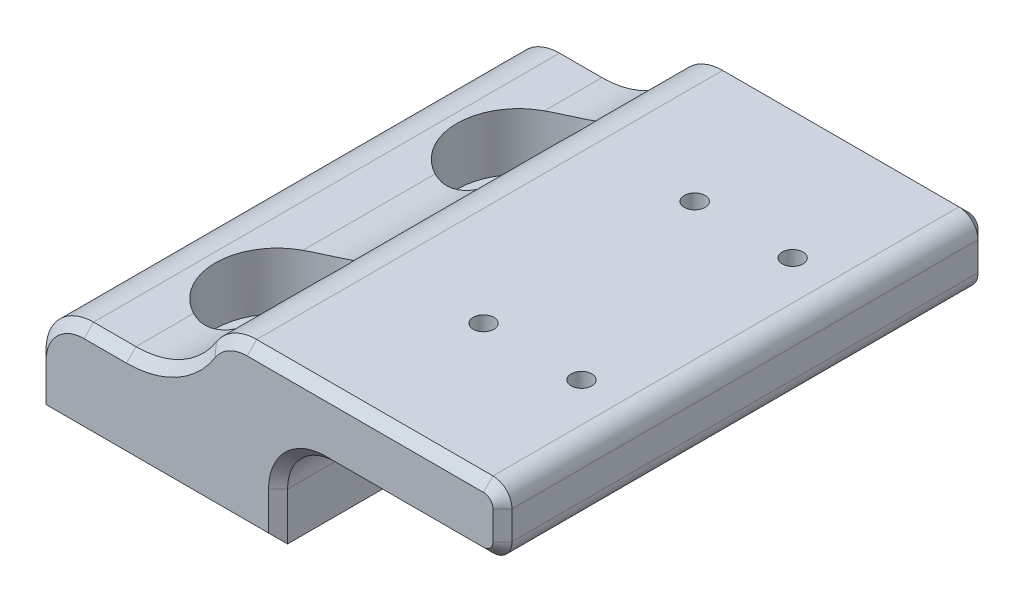
from build123d import *

# Parameters (mm, degrees)
BOSS_EXTRUDE1_DEPTH = 25.5
SKETCH3_R           = 2.921
CUT_EXTRUDE1_DEPTH  = 39.320882036
SKETCH3_4_R         = 6.5
SKETCH3_4_R_2       = 2.921
CUT_EXTRUDE2_DEPTH  = 6
SKETCH9_R           = 1.0922
CUT_EXTRUDE3_DEPTH  = 41.712283159
FILLET1_R           = 10
FILLET2_R           = 5
FILLET4_R           = 2
CHAMFER1_SIZE       = 1


with BuildPart() as part:
    # Sketch1 → Boss-Extrude1 (new, symmetric)
    with BuildSketch(Plane.XY):
        Polygon((-22.2, -8.5), (3.2, -8.5), (3.2, 1.5), (26.8, 1.5), (26.8, 8.5), (-3.2, 8.5), (-3.2, 1.5), (-22.2, 1.5), align=None)
    extrude(amount=BOSS_EXTRUDE1_DEPTH, both=True)

    # Sketch3 → Cut-Extrude1 (cut, through all)
    with BuildSketch(Plane(origin=(0, 1.5, 0), x_dir=(1, 0, 0), z_dir=(0, 1, 0))):
        with Locations(Location((-9.7, -12.7, 0), (0, 0, 180))):
            Circle(SKETCH3_R)
    cut_extrude1 = extrude(amount=-CUT_EXTRUDE1_DEPTH, mode=Mode.SUBTRACT)

    # Sketch3<4> → Cut-Extrude2 (cut)
    with BuildSketch(Plane(origin=(0, 1.5, 0), x_dir=(1, 0, 0), z_dir=(0, 1, 0))):
        with Locations(Location((-9.7, -12.7, 0), (0, 0, 180))):
            Circle(SKETCH3_4_R)
        with Locations(Location((-9.7, -12.7, 0), (0, 0, 180))):
            Circle(SKETCH3_4_R_2, mode=Mode.SUBTRACT)
    cut_extrude2 = extrude(amount=-CUT_EXTRUDE2_DEPTH, mode=Mode.SUBTRACT)

    # Mirror1: Cut-Extrude1, Cut-Extrude2 across plane
    add(cut_extrude1.mirror(Plane.XY), mode=Mode.SUBTRACT)
    add(cut_extrude2.mirror(Plane.XY), mode=Mode.SUBTRACT)

    # Sketch9 → Cut-Extrude3 (cut, through all)
    with BuildSketch(Plane(origin=(0, 8.5, 0), x_dir=(1, 0, 0), z_dir=(0, 1, 0))):
        with Locations(Location((10.4078, 11.1, 0), (0, 0, 180))):
            Circle(SKETCH9_R)
        with Locations(Location((20.7078, -11.1, 0), (0, 0, 180))):
            Circle(SKETCH9_R)
        with Locations(Location((20.7078, 11.1, 0), (0, 0, 180))):
            Circle(SKETCH9_R)
        with Locations(Location((10.4078, -11.1, 0), (0, 0, 180))):
            Circle(SKETCH9_R)
    extrude(amount=-CUT_EXTRUDE3_DEPTH, mode=Mode.SUBTRACT)

    # Fillet1
    # the kernel refuses this fillet: 10 mm, written as the material it adds along each edge
    with BuildSketch(Plane(origin=(-3.2, 1.5, 25.5), x_dir=(0, 1, 0), z_dir=(0, 0, -1))) as fillet1_piece_1_section:
        with BuildLine():
            CenterArc((10, -9.539392014), FILLET1_R, 107.457603124, 72.542396876)
            Line((0, -9.539392014), (0, 0))
            Line((0, 0), (7, 0))
        make_face()
    fillet1_piece_1 = extrude(amount=12.8, mode=Mode.PRIVATE)
    fillet1_piece_1 = fillet1_piece_1 - Plane(origin=(-9.7, 1.5, 12.7), x_dir=(-1, 0, 0), z_dir=(0, 1, 0)) * Cylinder(6.5, 64, mode=Mode.PRIVATE)
    add(fillet1_piece_1)
    with BuildSketch(Plane(origin=(-3.2, 1.5, -12.700000035), x_dir=(0, 1, 0), z_dir=(0, 0, -1))) as fillet1_piece_2_section:
        with BuildLine():
            CenterArc((10, -9.539392014), FILLET1_R, 107.457603124, 72.542396876)
            Line((0, -9.539392014), (0, 0))
            Line((0, 0), (7, 0))
        make_face()
    fillet1_piece_2 = extrude(amount=12.799999965, mode=Mode.PRIVATE)
    fillet1_piece_2 = fillet1_piece_2 - Plane(origin=(-9.7, 1.5, -12.7), x_dir=(-1, 0, 0), z_dir=(0, 1, 0)) * Cylinder(6.5, 64, mode=Mode.PRIVATE)
    add(fillet1_piece_2)
    with BuildSketch(Plane(origin=(-3.2, 1.5, 12.7), x_dir=(0, 1, 0), z_dir=(0, 0, -1))) as fillet1_piece_3_section:
        with BuildLine():
            CenterArc((10, -9.539392014), FILLET1_R, 107.457603124, 72.542396876)
            Line((0, -9.539392014), (0, 0))
            Line((0, 0), (7, 0))
        make_face()
    fillet1_piece_3 = extrude(amount=25.400000035, mode=Mode.PRIVATE)
    fillet1_piece_3 = fillet1_piece_3 - Plane(origin=(-9.7, 1.5, -12.7), x_dir=(-1, 0, 0), z_dir=(0, 1, 0)) * Cylinder(6.5, 89, mode=Mode.PRIVATE)
    fillet1_piece_3 = fillet1_piece_3 - Plane(origin=(-9.7, 1.5, 12.7), x_dir=(-1, 0, 0), z_dir=(0, 1, 0)) * Cylinder(6.5, 89, mode=Mode.PRIVATE)
    add(fillet1_piece_3)

    # Fillet2
    # the kernel refuses this fillet: 5 mm, written as the material it adds along each edge
    with BuildSketch(Plane(origin=(3.2, 1.5, -25.5), x_dir=(0, -1, 0), z_dir=(0, 0, 1))) as fillet2_piece_1:
        with BuildLine():
            CenterArc((FILLET2_R, FILLET2_R), FILLET2_R, 180, 90)
            Line((0, FILLET2_R), (0, 0))
            Line((0, 0), (FILLET2_R, 0))
        make_face()
    extrude(amount=51)
    # the kernel refuses this fillet: 5 mm, written as the material it takes off along each edge
    with BuildSketch(Plane(origin=(-3.2, 8.5, -33.372963816), x_dir=(1, 0, 0), z_dir=(0, 0, 1))) as fillet2_2_piece_1:
        with BuildLine():
            CenterArc((3.149185526, -5), FILLET2_R, 90, 57.769047364)
            ThreePointArc((-1.080340321, -2.333333333), (-0.464861443, -1.201534828), (0, 0))
            Line((0, 0), (3.149185526, 0))
        make_face()
    extrude(amount=20.67296378, mode=Mode.SUBTRACT)
    with BuildSketch(Plane(origin=(-22.2, 1.5, 38), x_dir=(1, 0, 0), z_dir=(0, 0, -1))) as fillet2_2_piece_2:
        with BuildLine():
            CenterArc((FILLET2_R, FILLET2_R), FILLET2_R, 180, 90)
            Line((0, FILLET2_R), (0, 0))
            Line((0, 0), (FILLET2_R, 0))
        make_face()
    extrude(amount=76, mode=Mode.SUBTRACT)
    with BuildSketch(Plane(origin=(-3.2, 8.5, -12.700000035), x_dir=(-0.42015348282673015, -0.9074530571156663, 0), z_dir=(0, 0, 1))) as fillet2_2_piece_3:
        with BuildLine():
            CenterArc((3.214124019, 4.958505447), FILLET2_R, 204.84427788, 57.769047364)
            Line((-1.323141267, 2.857738033), (0, 0))
            ThreePointArc((0, 0), (1.285649607, 0.082989105), (2.571299215, 0))
        make_face()
    extrude(amount=25.400000035, mode=Mode.SUBTRACT)
    with BuildSketch(Plane(origin=(-3.2, 8.5, 12.7), x_dir=(1, 0, 0), z_dir=(0, 0, 1))) as fillet2_2_piece_4:
        with BuildLine():
            CenterArc((3.149185526, -5), FILLET2_R, 90, 57.769047364)
            ThreePointArc((-1.080340321, -2.333333333), (-0.464861443, -1.201534828), (0, 0))
            Line((0, 0), (3.149185526, 0))
        make_face()
    extrude(amount=20.672963816, mode=Mode.SUBTRACT)

    # Fillet4
    fillet4_edges = [part.edges().sort_by_distance(p)[0] for p in [
        (26.8, 8.5, 0),
        (26.8, 1.5, 0),
    ]]
    fillet(fillet4_edges, radius=FILLET4_R)

    # Chamfer1
    chamfer1_edges = [part.edges().sort_by_distance(p)[0] for p in [
        (3.2, -6, -25.5),
        (12.374592763, 8.5, 25.5),
        (-9.5, -8.5, -25.5),
        (12.374592763, 8.5, -25.5),
        (26.8, 5, -25.5),
        (26.214213562, 2.085786438, -25.5),
        (26.214213562, 7.914213562, -25.5),
        (26.8, 5, 25.5),
        (26.214213562, 2.085786438, 25.5),
        (26.214213562, 7.914213562, 25.5),
        (3.2, -6, 25.5),
        (-14.969696007, 1.5, -25.5),
        (-14.969696007, 1.5, 25.5),
        (-7.908933099, 2.744049642, -25.5),
        (-7.908933099, 2.744049642, 25.5),
        (-22.2, -6, 25.5),
        (16.5, 1.5, 25.5),
        (-20.735533906, 0.035533906, 25.5),
        (-2.466043931, 7.877975179, 25.5),
        (-22.2, -6, -25.5),
        (-9.5, -8.5, 25.5),
        (16.5, 1.5, -25.5),
        (-20.735533906, 0.035533906, -25.5),
        (-2.466043931, 7.877975179, -25.5),
        (4.664466094, 0.035533906, -25.5),
        (4.664466094, 0.035533906, 25.5),
    ]]
    chamfer(chamfer1_edges, length=CHAMFER1_SIZE)


solid = part.part
